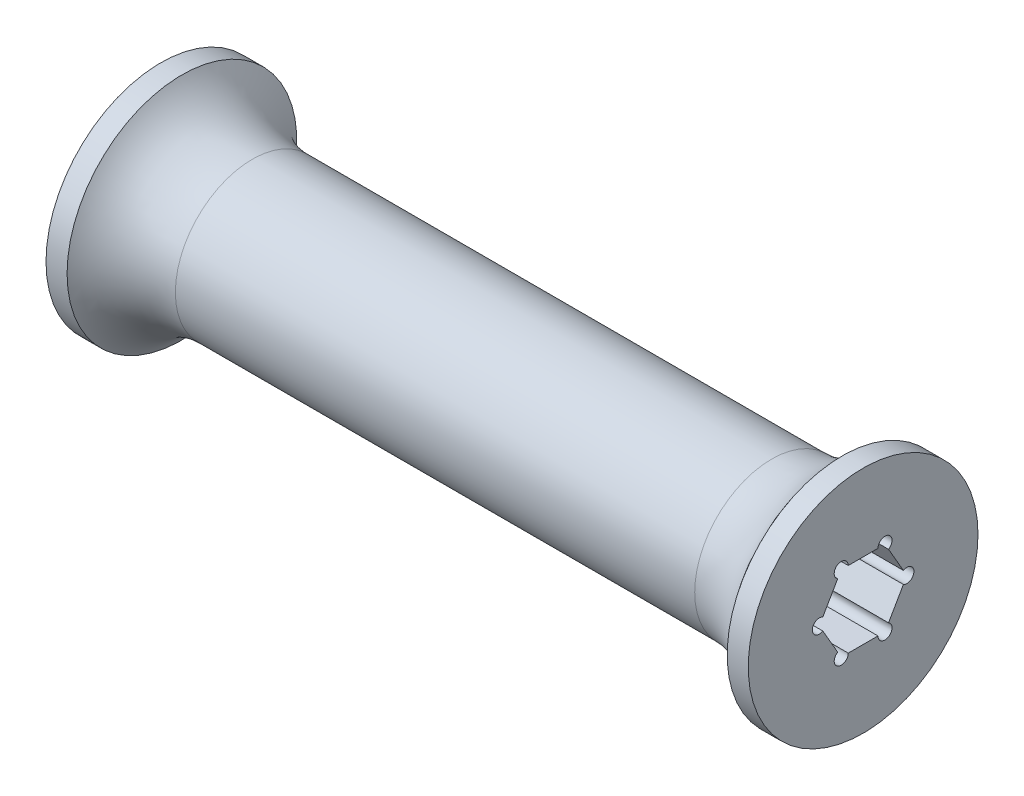
from build123d import *

# Parameters (mm, degrees)
SKETCH1_R           = 13.918584035
BOSS_EXTRUDE1_DEPTH = 63.5
BOSS_EXTRUDE2_START = -3.81
SKETCH3_R           = 20.776584035
SKETCH3_R_2         = 13.918584035
BOSS_EXTRUDE2_DEPTH = 3.81
FILLET1_R           = 15.24
SKETCH4_R           = 20.776584035
SKETCH4_R_2         = 13.918584035
BOSS_EXTRUDE3_DEPTH = 3.81
FILLET2_R           = 15.24
SKETCH7_R           = 1.27
CUT_EXTRUDE1_DEPTH  = 419.299996556


with BuildPart() as part:
    # Sketch1 → Boss-Extrude1 (new, symmetric)
    with BuildSketch(Plane(origin=(0, 0, 0), x_dir=(0, 0, -1), z_dir=(1, 0, 0))):
        with Locations((364.49, 81.28)):
            Circle(SKETCH1_R)
    extrude(amount=BOSS_EXTRUDE1_DEPTH, both=True)

    # Sketch3 → Boss-Extrude2 (add)
    with BuildSketch(Plane.ZY.offset(63.5).offset(BOSS_EXTRUDE2_START)):
        with Locations((-364.49, 81.28)):
            Circle(SKETCH3_R)
        with Locations((-364.49, 81.28)):
            Circle(SKETCH3_R_2, mode=Mode.SUBTRACT)
    extrude(amount=BOSS_EXTRUDE2_DEPTH)

    # Fillet1
    # the kernel refuses this fillet: 15.24 mm, written as the material it adds along each edge
    with BuildSketch(Plane(origin=(-59.69, 81.28, -364.49), x_dir=(0, 0, -1), z_dir=(0, -1, 0))) as fillet1_piece_1:
        with BuildLine():
            CenterArc((29.158584035, 12.727909333), FILLET1_R, 180, 56.632987031)
            Line((20.776584035, 0), (20.608944035, -0.254558187))
            ThreePointArc((20.608944035, -0.254558187), (17.347584035, -0.3048), (13.918584035, -0.3048))
            Line((13.918584035, -0.3048), (13.613784035, 0))
            Line((13.613784035, 0), (13.613784035, 12.727909333))
            Line((13.613784035, 12.727909333), (13.918584035, 12.727909333))
        make_face()
    revolve(axis=Axis((-59.69, 81.28, -364.49), (1, 0, 0)))

    # Sketch4 → Boss-Extrude3 (add)
    with BuildSketch(Plane(origin=(63.5, 0, 0), x_dir=(0, 0, -1), z_dir=(1, 0, 0))):
        with Locations(Location((364.49, 81.28, 0), (0, 0, 180))):
            Circle(SKETCH4_R)
        with Locations(Location((364.49, 81.28, 0), (0, 0, 180))):
            Circle(SKETCH4_R_2, mode=Mode.SUBTRACT)
    extrude(amount=-BOSS_EXTRUDE3_DEPTH)

    # Fillet2
    # the kernel refuses this fillet: 15.24 mm, written as the material it adds along each edge
    with BuildSketch(Plane(origin=(59.69, 81.28, -364.49), x_dir=(0, 0, -1), z_dir=(0, 1, 0))) as fillet2_piece_1:
        with BuildLine():
            CenterArc((29.158584035, 12.727909333), FILLET2_R, 180, 56.632987031)
            Line((20.776584035, 0), (20.608944035, -0.254558187))
            ThreePointArc((20.608944035, -0.254558187), (17.347584035, -0.3048), (13.918584035, -0.3048))
            Line((13.918584035, -0.3048), (13.613784035, 0))
            Line((13.613784035, 0), (13.613784035, 12.727909333))
            Line((13.613784035, 12.727909333), (13.918584035, 12.727909333))
        make_face()
    revolve(axis=Axis((59.69, 81.28, -364.49), (-1, 0, 0)))

    # Sketch7 → Cut-Extrude1 (cut, through all)
    with BuildSketch(Plane(origin=(63.5, 0, 0), x_dir=(0, 0, -1), z_dir=(1, 0, 0))):
        with Locations((372.408936292, 81.28)):
            Circle(SKETCH7_R)
        with Locations((368.449468146, 88.138)):
            Circle(SKETCH7_R)
        with Locations((360.530531854, 88.138)):
            Circle(SKETCH7_R)
        with Locations((356.571063708, 81.28)):
            Circle(SKETCH7_R)
        with Locations((360.530531854, 74.422)):
            Circle(SKETCH7_R)
        with Locations((368.449468146, 74.422)):
            Circle(SKETCH7_R)
        Polygon((372.408936292, 81.28), (368.449468146, 88.138), (360.530531854, 88.138), (356.571063708, 81.28), (360.530531854, 74.422), (368.449468146, 74.422), align=None)
        with BuildLine():
            ThreePointArc((359.895531854, 87.038147737), (361.165531854, 87.038147737), (361.800531854, 88.138))
            Line((361.800531854, 88.138), (360.530531854, 88.138))
            Line((360.530531854, 88.138), (359.895531854, 87.038147737))
        make_face()
        with BuildLine():
            Line((360.530531854, 88.138), (361.800531854, 88.138))
            ThreePointArc((361.800531854, 88.138), (359.895531854, 89.237852263), (359.895531854, 87.038147737))
            Line((359.895531854, 87.038147737), (360.530531854, 88.138))
        make_face()
        with BuildLine():
            ThreePointArc((357.841063708, 81.28), (357.670915971, 81.915), (357.206063708, 82.379852263))
            Line((357.206063708, 82.379852263), (356.571063708, 81.28))
            Line((356.571063708, 81.28), (357.206063708, 80.180147737))
            ThreePointArc((357.206063708, 80.180147737), (357.670915971, 80.645), (357.841063708, 81.28))
        make_face()
        with BuildLine():
            Line((356.571063708, 81.28), (357.206063708, 82.379852263))
            ThreePointArc((357.206063708, 82.379852263), (355.301063708, 81.28), (357.206063708, 80.180147737))
            Line((357.206063708, 80.180147737), (356.571063708, 81.28))
        make_face()
        with BuildLine():
            ThreePointArc((359.895531854, 75.521852263), (359.895531854, 73.322147737), (361.800531854, 74.422))
            Line((361.800531854, 74.422), (360.530531854, 74.422))
            Line((360.530531854, 74.422), (359.895531854, 75.521852263))
        make_face()
        with BuildLine():
            Line((360.530531854, 74.422), (361.800531854, 74.422))
            ThreePointArc((361.800531854, 74.422), (361.165531854, 75.521852263), (359.895531854, 75.521852263))
            Line((359.895531854, 75.521852263), (360.530531854, 74.422))
        make_face()
        with BuildLine():
            ThreePointArc((367.179468146, 88.138), (367.814468146, 87.038147737), (369.084468146, 87.038147737))
            Line((369.084468146, 87.038147737), (368.449468146, 88.138))
            Line((368.449468146, 88.138), (367.179468146, 88.138))
        make_face()
        with BuildLine():
            Line((368.449468146, 88.138), (369.084468146, 87.038147737))
            ThreePointArc((369.084468146, 87.038147737), (369.549320409, 87.503), (369.719468146, 88.138))
            ThreePointArc((369.719468146, 88.138), (368.449468146, 89.408), (367.179468146, 88.138))
            Line((367.179468146, 88.138), (368.449468146, 88.138))
        make_face()
        with BuildLine():
            Line((371.773936292, 80.180147737), (372.408936292, 81.28))
            Line((372.408936292, 81.28), (371.773936292, 82.379852263))
            ThreePointArc((371.773936292, 82.379852263), (371.138936292, 81.28), (371.773936292, 80.180147737))
        make_face()
        with BuildLine():
            Line((371.773936292, 82.379852263), (372.408936292, 81.28))
            Line((372.408936292, 81.28), (371.773936292, 80.180147737))
            ThreePointArc((371.773936292, 80.180147737), (373.043936292, 80.180147737), (373.678936292, 81.28))
            ThreePointArc((373.678936292, 81.28), (373.043936292, 82.379852263), (371.773936292, 82.379852263))
        make_face()
        with BuildLine():
            ThreePointArc((369.719468146, 74.422), (369.549320409, 75.057), (369.084468146, 75.521852263))
            Line((369.084468146, 75.521852263), (368.449468146, 74.422))
            Line((368.449468146, 74.422), (367.179468146, 74.422))
            ThreePointArc((367.179468146, 74.422), (368.449468146, 73.152), (369.719468146, 74.422))
        make_face()
        with BuildLine():
            Line((368.449468146, 74.422), (369.084468146, 75.521852263))
            ThreePointArc((369.084468146, 75.521852263), (367.814468146, 75.521852263), (367.179468146, 74.422))
            Line((367.179468146, 74.422), (368.449468146, 74.422))
        make_face()
    extrude(amount=-CUT_EXTRUDE1_DEPTH, mode=Mode.SUBTRACT)


solid = part.part
